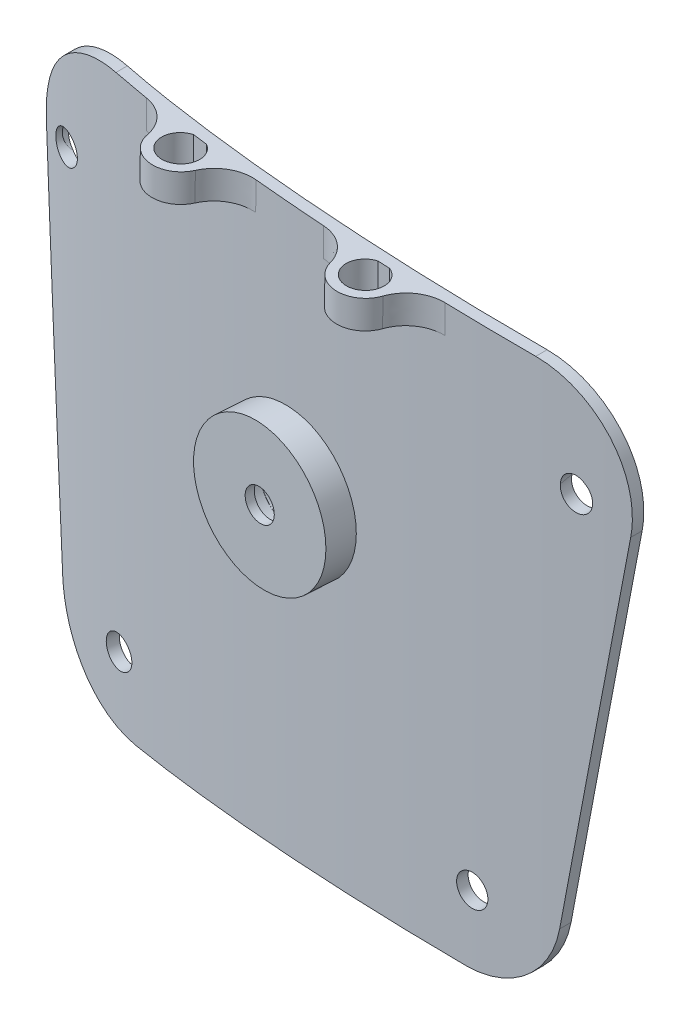
from build123d import *

# Parameters (mm, degrees)
BOSS_EXTRUDE1_DEPTH      = 20
FILLET1_R                = 10
CUT_EXTRUDE1_DEPTH       = 100
CUT_EXTRUDE1_DEPTH_BACK  = 100
CUT_EXTRUDE4_DEPTH       = 25
CUT_EXTRUDE4_DEPTH_BACK  = 10
SKETCH3_R                = 1.55
CUT_EXTRUDE6_DEPTH       = 10
CUT_EXTRUDE6_DEPTH_BACK  = 10
SKETCH6_R                = 1.65
CUT_EXTRUDE7_DEPTH       = 10
CUT_EXTRUDE7_DEPTH_BACK  = 10
SKETCH7_R                = 1.65
CUT_EXTRUDE8_DEPTH       = 10
CUT_EXTRUDE8_DEPTH_BACK  = 10
SKETCH8_R                = 1.65
CUT_EXTRUDE9_DEPTH       = 10
CUT_EXTRUDE9_DEPTH_BACK  = 10
SKETCH9_R                = 1.65
CUT_EXTRUDE10_DEPTH      = 10
CUT_EXTRUDE10_DEPTH_BACK = 10
SKETCH10_R               = 1.65
SKETCH11_R               = 7.5
SKETCH11_R_2             = 1.65
BOSS_EXTRUDE5_DEPTH      = 3
SKETCH12_R               = 3.502284732
CUT_EXTRUDE11_DEPTH      = 3.5
SKETCH16_R               = 3
SKETCH16_R_2             = 2
BOSS_EXTRUDE6_DEPTH      = 3
FILLET5_R                = 4
SKETCH14_R               = 65.566720857
CUT_EXTRUDE12_DEPTH      = 93


with BuildPart() as part:
    # Sketch1 → Boss-Extrude1 (new body)
    with BuildSketch(Plane.XY):
        Polygon((8.480028905, 36.364162969), (19.360902256, -22.640977444), (74.360902256, -22.640977444), (78.472958937, 37.359022556), align=None)
    extrude(amount=BOSS_EXTRUDE1_DEPTH)

    # Fillet1
    fillet1_edges = [part.edges().sort_by_distance(p)[0] for p in [
        (74.360902256, -22.640977444, 10),
        (19.360902256, -22.640977444, 10),
        (8.480028905, 36.364162969, 10),
        (78.472958937, 37.359022556, 10),
    ]]
    fillet(fillet1_edges, radius=FILLET1_R)

    # Sketch2 → Cut-Extrude1 (cut, two sides: drawn at the far end of the back side and taken through both)
    with BuildSketch(Plane(origin=(0, 0, 0), x_dir=(1, 0, 0), z_dir=(0, 1, 0)).offset(-CUT_EXTRUDE1_DEPTH_BACK)):
        Polygon((-34.439432477, 11.630216334), (-34.439432477, -22.926204047), (85.315807502, -26.767134305), (85.315807502, 11.630216334), align=None)
        with BuildLine():
            add(Edge.make_bspline(
                [(-29.855816864, -9.239413225), (-29.855816864, -18.784022849), (27.570578004, -18.473949578), (84.996972871, -18.163876308), (81.265779923, -8.639413225)],
                knots=[0, 0, 0, 1.603288786, 1.603288786, 3.206577572, 3.206577572, 3.206577572], degree=2, weights=[1, 0.695526153, 1, 0.695526153, 1]))
            add(Edge.make_bspline(
                [(-29.738416516, -8.639413225), (-29.855816864, -8.939096274), (-29.855816864, -9.239413225)],
                knots=[6.218200389, 6.218200389, 6.218200389, 6.283185307, 6.283185307, 6.283185307], degree=2, weights=[1, 0.999472166, 1]))
            add(Edge.make_bspline(
                [(-29.738416516, -8.639413225), (-26.353940413, -17.27882645), (25.763681703, -17.27882645), (77.88130382, -17.27882645), (81.265779923, -8.639413225)],
                knots=[0.064984918, 0.064984918, 0.064984918, 1.570796327, 1.570796327, 3.076607735, 3.076607735, 3.076607735], degree=2, weights=[1, 0.729705142, 1, 0.729705142, 1]))
        make_face(mode=Mode.SUBTRACT)
    extrude(amount=CUT_EXTRUDE1_DEPTH + CUT_EXTRUDE1_DEPTH_BACK, mode=Mode.SUBTRACT)

    # Sketch3 → Cut-Extrude4 (cut, two sides: drawn at the far end of the back side and taken through both)
    with BuildSketch(Plane.XY.offset(-CUT_EXTRUDE4_DEPTH_BACK)):
        with Locations((16.216885375, 26.155587251)):
            Circle(SKETCH3_R)
        with Locations((74.386282507, 26.155587251)):
            Circle(SKETCH3_R)
        with Locations((46.83646973, 10.811243215)):
            Circle(SKETCH3_R)
        with Locations((27.022046053, -15.396700442)):
            Circle(SKETCH3_R)
        with Locations((67.117888375, -15.396700442)):
            Circle(SKETCH3_R)
    extrude(amount=CUT_EXTRUDE4_DEPTH + CUT_EXTRUDE4_DEPTH_BACK, mode=Mode.SUBTRACT)

    # Sketch6 → Cut-Extrude6 (cut, two sides: drawn at the far end of the back side and taken through both)
    with BuildSketch(Plane(origin=(-0.434189407, -0.02532877, 15.636095985), x_dir=(0.9996146817388931, -4.267460377470012e-05, 0.02775763374154417), z_dir=(-0.027757666451138998, -0.0016192646033559705, 0.9996133702263749)).offset(-CUT_EXTRUDE6_DEPTH_BACK)):
        with Locations((16.631434418, 25.996715933)):
            Circle(SKETCH6_R)
    extrude(amount=CUT_EXTRUDE6_DEPTH + CUT_EXTRUDE6_DEPTH_BACK, mode=Mode.SUBTRACT)

    # Sketch7 → Cut-Extrude7 (cut, two sides: drawn at the far end of the back side and taken through both)
    with BuildSketch(Plane(origin=(1.442680004, 0.036490093, 20.936154169), x_dir=(-0.9976342349499691, 0.00012752404454944926, 0.06874530524630935), z_dir=(-0.06874542309626006, -0.0017387964383983705, -0.9976327196870911)).offset(-CUT_EXTRUDE7_DEPTH_BACK)):
        with Locations((-45.495991738, 10.77824272)):
            Circle(SKETCH7_R)
    extrude(amount=CUT_EXTRUDE7_DEPTH + CUT_EXTRUDE7_DEPTH_BACK, mode=Mode.SUBTRACT)

    # Sketch8 → Cut-Extrude8 (cut, two sides: drawn at the far end of the back side and taken through both)
    with BuildSketch(Plane(origin=(0.117902929, -2.694e-06, 19.836473006), x_dir=(0.9999823364183166, 8.071460196158378e-10, -0.005943639572242173), z_dir=(0.005943639572242228, -1.3579756186691197e-07, 0.9999823364183075)).offset(-CUT_EXTRUDE8_DEPTH_BACK)):
        with Locations((26.85424289, -15.440225553)):
            Circle(SKETCH8_R)
    extrude(amount=CUT_EXTRUDE8_DEPTH + CUT_EXTRUDE8_DEPTH_BACK, mode=Mode.SUBTRACT)

    # Sketch9 → Cut-Extrude9 (cut, two sides: drawn at the far end of the back side and taken through both)
    with BuildSketch(Plane(origin=(4.942820891, 0.013184332, 26.867865743), x_dir=(-0.9834954907347486, 0.000749052697050044, 0.18093108805419061), z_dir=(-0.18093147327694167, -0.000482611167730129, -0.9834955867030092)).offset(-CUT_EXTRUDE9_DEPTH_BACK)):
        with Locations((-63.380681925, -15.352539894)):
            Circle(SKETCH9_R)
    extrude(amount=CUT_EXTRUDE9_DEPTH + CUT_EXTRUDE9_DEPTH_BACK, mode=Mode.SUBTRACT)

    # Sketch10 → Cut-Extrude10 (cut, two sides: drawn at the far end of the back side and taken through both)
    with BuildSketch(Plane(origin=(10.12372784, 0.537782091, 33.551090878), x_dir=(-0.9573766734033836, 0.004629187613499617, 0.28880525591669903), z_dir=(-0.28884235358248794, -0.015343581656236397, -0.9572537120737048)).offset(-CUT_EXTRUDE10_DEPTH_BACK)):
        with Locations((-67.275911857, 25.905547298)):
            Circle(SKETCH10_R)
    extrude(amount=CUT_EXTRUDE10_DEPTH + CUT_EXTRUDE10_DEPTH_BACK, mode=Mode.SUBTRACT)

    # Sketch11 → Boss-Extrude5 (add)
    with BuildSketch(Plane(origin=(1.442680004, 0.036490093, 20.936154169), x_dir=(-0.9976342349499691, 0.00012752404454944926, 0.06874530524630935), z_dir=(-0.06874542309626006, -0.0017387964383983705, -0.9976327196870911))):
        with Locations((-45.479468253, 10.769075344)):
            Circle(SKETCH11_R)
        with Locations((-45.479468253, 10.769075344)):
            Circle(SKETCH11_R_2, mode=Mode.SUBTRACT)
    extrude(amount=-BOSS_EXTRUDE5_DEPTH)

    # Sketch12 → Cut-Extrude11 (cut)
    with BuildSketch(Plane(origin=(1.346436412, 0.034055778, 19.539468362), x_dir=(0.9976342349795922, -0.00011981775749547257, -0.06874531867981117), z_dir=(0.06874542309626006, 0.0017387964383983705, 0.9976327196870911))):
        with Locations((45.479551241, 10.768724866)):
            Circle(SKETCH12_R)
    extrude(amount=CUT_EXTRUDE11_DEPTH, mode=Mode.SUBTRACT)

    # Sketch16 → Boss-Extrude6 (add)
    # profile 1 of 2: a face of its own
    with BuildSketch(Plane(origin=(-0.515052589, 36.236309441, 0), x_dir=(0.999899000450749, 0.014212279816874786, 0), z_dir=(-0.014212279816874786, 0.999899000450749, 0))):
        with Locations((57.962949227, -18.685752515)):
            Circle(SKETCH16_R)
        with Locations((57.962949227, -18.685752515)):
            Circle(SKETCH16_R_2, mode=Mode.SUBTRACT)
    # profile 2 of 2: a face of its own
    with BuildSketch(Plane(origin=(-0.515052589, 36.236309441, 0), x_dir=(0.999899000450749, 0.014212279816874786, 0), z_dir=(-0.014212279816874786, 0.999899000450749, 0))):
        with Locations((37.020581063, -20.206612845)):
            Circle(SKETCH16_R)
        with Locations((37.020581063, -20.206612845)):
            Circle(SKETCH16_R_2, mode=Mode.SUBTRACT)
    extrude(amount=-BOSS_EXTRUDE6_DEPTH)

    # Fillet5
    fillet5_edges = [part.edges().sort_by_distance(p)[0] for p in [
        (59.593276038, 35.590520896, 16.573278928),
        (54.911740767, 35.523978888, 17.108438427),
        (34.148753947, 35.228859706, 18.373226715),
        (38.773084927, 35.294588631, 18.22253112),
    ]]
    fillet(fillet5_edges, radius=FILLET5_R)


with BuildPart() as body_2:
    # Mirror2: mirrored copy
    add(part.part.mirror(Plane(origin=(0, 0, 0), x_dir=(0, 0, 1), z_dir=(1, 0, 0))))


with BuildPart() as part_1:
    add(part.part)

    # Sketch14 → Cut-Extrude12 (cut)
    with BuildSketch(Plane(origin=(0, 0, 0), x_dir=(0, 0, -1), z_dir=(1, 0, 0))):
        with Locations((-13.645050173, 8.650126349)):
            Circle(SKETCH14_R)
    extrude(amount=CUT_EXTRUDE12_DEPTH, mode=Mode.SUBTRACT)


solid = body_2.part
